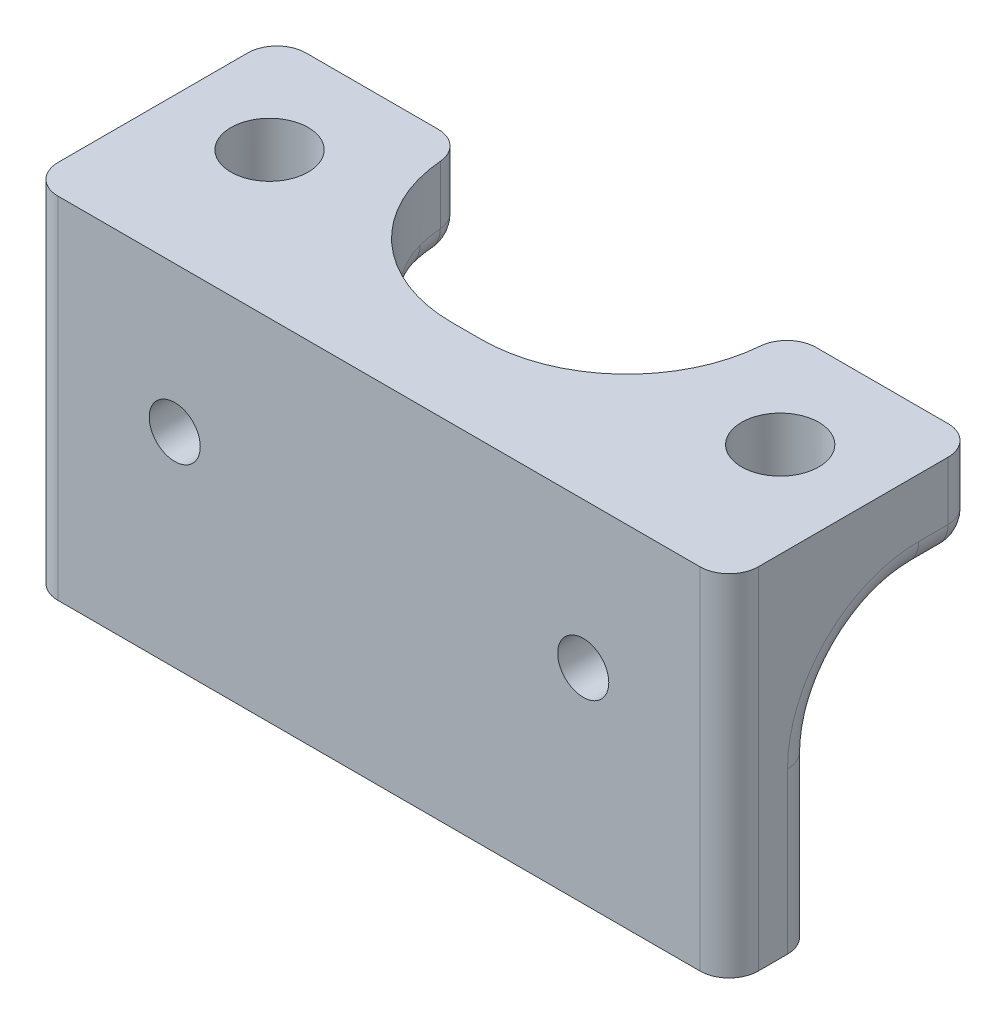
from build123d import *

# Parameters (mm, degrees)
SKETCH1_W           = 24
SKETCH1_H           = 12
BOSS_EXTRUDE1_DEPTH = 1.5
SKETCH2_W           = 6.5
SKETCH2_H           = 5.5
BOSS_EXTRUDE2_DEPTH = 3
SKETCH6_R           = 1.325
CUT_EXTRUDE1_DEPTH  = 17.552945357
SKETCH7_R           = 1.325
CUT_EXTRUDE2_DEPTH  = 17.552945357
FILLET1_R           = 3.5
FILLET2_R           = 5
FILLET3_R           = 1
FILLET5_R           = 1
SKETCH8_R           = 0.875
CUT_EXTRUDE4_DEPTH  = 16.882380341


# Some blends are built 0.0001 mm under size
with BuildPart() as part:
    # Sketch1 → Boss-Extrude1 (new, symmetric)
    with BuildSketch(Plane.XY):
        Rectangle(SKETCH1_W, SKETCH1_H)
    extrude(amount=BOSS_EXTRUDE1_DEPTH, both=True)

    # Sketch2 → Boss-Extrude2 (add)
    with BuildSketch(Plane(origin=(0, 6, 0), x_dir=(1, 0, 0), z_dir=(0, 1, 0))):
        with Locations((8.75, 4.25)):
            Rectangle(SKETCH2_W, SKETCH2_H)
        with Locations((-8.75, 4.25)):
            Rectangle(SKETCH2_W, SKETCH2_H)
    extrude(amount=-BOSS_EXTRUDE2_DEPTH)

    # Sketch6 → Cut-Extrude1 (cut, through all)
    with BuildSketch(Plane.XZ.offset(-3)):
        with Locations(Location((-8.75, -3.5, 0), (0, 0, 270))):
            Circle(SKETCH6_R)
    extrude(amount=-CUT_EXTRUDE1_DEPTH, mode=Mode.SUBTRACT)

    # Sketch7 → Cut-Extrude2 (cut, through all)
    with BuildSketch(Plane.XZ.offset(-3)):
        with Locations(Location((8.75, -3.5, 0), (0, 0, 270))):
            Circle(SKETCH7_R)
    extrude(amount=-CUT_EXTRUDE2_DEPTH, mode=Mode.SUBTRACT)

    # Fillet1
    # the kernel refuses this fillet: 3.5 mm, written as the material it adds along each edge
    with BuildSketch(Plane(origin=(5.5, 3, -1.5), x_dir=(0, -1, 0), z_dir=(1, 0, 0))) as fillet1_piece_1_section:
        with BuildLine():
            CenterArc((FILLET1_R, FILLET1_R), FILLET1_R, 180, 90)
            Line((0, FILLET1_R), (0, 0))
            Line((0, 0), (FILLET1_R, 0))
        make_face()
    fillet1_piece_1 = extrude(amount=6.5, mode=Mode.PRIVATE)
    fillet1_piece_1 = fillet1_piece_1 - Plane(origin=(8.75, 2.130609202, -3.5), x_dir=(0, 0, -1), z_dir=(0, -1, 0)) * Cylinder(1.325, 27, mode=Mode.PRIVATE)
    add(fillet1_piece_1)
    with BuildSketch(Plane(origin=(-12, 3, -1.5), x_dir=(0, -1, 0), z_dir=(1, 0, 0))) as fillet1_piece_2_section:
        with BuildLine():
            CenterArc((FILLET1_R, FILLET1_R), FILLET1_R, 180, 90)
            Line((0, FILLET1_R), (0, 0))
            Line((0, 0), (FILLET1_R, 0))
        make_face()
    fillet1_piece_2 = extrude(amount=6.5, mode=Mode.PRIVATE)
    fillet1_piece_2 = fillet1_piece_2 - Plane(origin=(-8.75, 2.130609202, -3.5), x_dir=(0, 0, -1), z_dir=(0, -1, 0)) * Cylinder(1.325, 27, mode=Mode.PRIVATE)
    add(fillet1_piece_2)

    # Fillet2
    fillet2_edges = [part.edges().sort_by_distance(p)[0] for p in [
        (5.5, 2.75, -1.5),
        (-5.5, 2.75, -1.5),
    ]]
    fillet(fillet2_edges, radius=FILLET2_R)

    # Fillet3
    fillet3_edges = [part.edges().sort_by_distance(p)[0] for p in [
        (12, 4.5, -7),
        (-12, 4.5, -7),
        (5.5, 4.5, -7),
        (-5.5, 4.5, -7),
    ]]
    fillet(fillet3_edges, radius=FILLET3_R)

    # Fillet5
    fillet5_edges = [part.edges().sort_by_distance(p)[0] for p in [
        (8.739565186, 3, -7),
        (11.707106781, 3, -6.707106781),
        (5.802129531, 3, -6.735982243),
        (-5.406145562, 3, -5.535771954),
        (-8.739565186, 3, -7),
        (-11.707106781, 3, -6.707106781),
        (-5.802129531, 3, -6.735982243),
        (-12, 0, 1.5),
        (12, 0, 1.5),
        (12, 3, -5.5),
        (-12, -3.25, -1.5),
        (-12, 3, -5.5),
        (12, 1.974873734, -2.525126266),
        (-12, 1.974873734, -2.525126266),
        (12, -3.25, -1.5),
        (3.087209053, 1.628244963, -2.221408019),
        (5.406145562, 3, -5.535771954),
        (-3.087209053, 1.628244963, -2.221408019),
    ]]
    fillet(fillet5_edges, radius=FILLET5_R - 0.0004)  # a hair under: the kernel refuses the full size

    # Sketch8 → Cut-Extrude4 (cut, through all)
    with BuildSketch(Plane.XY.offset(1.5)):
        with Locations((7, 1)):
            Circle(SKETCH8_R)
        with Locations((-7, 1)):
            Circle(SKETCH8_R)
    extrude(amount=-CUT_EXTRUDE4_DEPTH, mode=Mode.SUBTRACT)


solid = part.part
